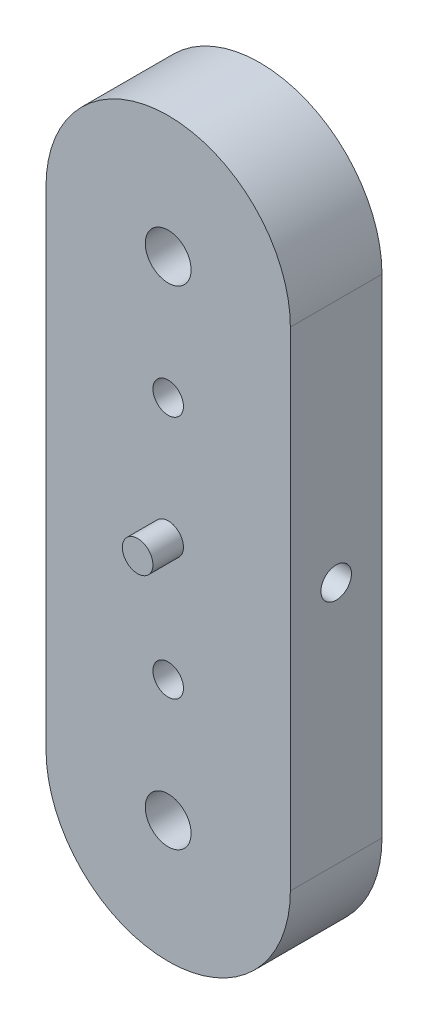
from build123d import *

# Parameters (mm, degrees)
BOSS_EXTRUDE1_DEPTH     = 38.1
SKETCH2_R               = 6.35
CUT_EXTRUDE1_DEPTH      = 277.034883433
ADVANCEDHOLE3_OUTLINE_R = 9.525
ADVANCEDHOLE3_DEPTH     = 38.1
SKETCH21_R              = 6.35
CUT_EXTRUDE2_DEPTH      = 35.56
SKETCH23_R              = 6.35
BOSS_EXTRUDE2_DEPTH     = 12.7


# Read off the part's stored shape, not the designer's step: AdvancedHole3
with BuildPart() as part:
    # Sketch1 → Boss-Extrude1 (new body)
    with BuildSketch(Plane.XY):
        with BuildLine():
            Line((0, 0), (0, 203.013094366))
            ThreePointArc((0, 203.013094366), (50.8, 253.813094366), (101.6, 203.013094366))
            Line((101.6, 203.013094366), (101.6, 0))
            ThreePointArc((101.6, 0), (50.8, -50.8), (0, 0))
        make_face()
    extrude(amount=BOSS_EXTRUDE1_DEPTH)

    # Sketch2 → Cut-Extrude1 (cut, through all)
    with BuildSketch(Plane(origin=(101.6, 0, 0), x_dir=(0, 0, -1), z_dir=(1, 0, 0))):
        with Locations(Location((-19.05, 101.506547183, 0), (0, 0, 90))):
            Circle(SKETCH2_R)
    extrude(amount=-CUT_EXTRUDE1_DEPTH, mode=Mode.SUBTRACT)

    # AdvancedHole3 outline → AdvancedHole3 (cut)
    with BuildSketch(Plane.XY):
        with Locations((50.8, 203.013094366)):
            Circle(ADVANCEDHOLE3_OUTLINE_R)
        with Locations((50.8, 0)):
            Circle(ADVANCEDHOLE3_OUTLINE_R)
    extrude(amount=ADVANCEDHOLE3_DEPTH, mode=Mode.SUBTRACT)

    # Sketch21 → Cut-Extrude2 (cut)
    with BuildSketch(Plane.XY.offset(38.1)):
        with Locations((50.8, 50.706547183)):
            Circle(SKETCH21_R)
        with Locations((50.8, 152.213094366)):
            Circle(SKETCH21_R)
    extrude(amount=-CUT_EXTRUDE2_DEPTH, mode=Mode.SUBTRACT)

    # Sketch23 → Boss-Extrude2 (add)
    with BuildSketch(Plane.XY.offset(38.1)):
        with Locations((50.8, 101.506547183)):
            Circle(SKETCH23_R)
    extrude(amount=BOSS_EXTRUDE2_DEPTH)


solid = part.part
